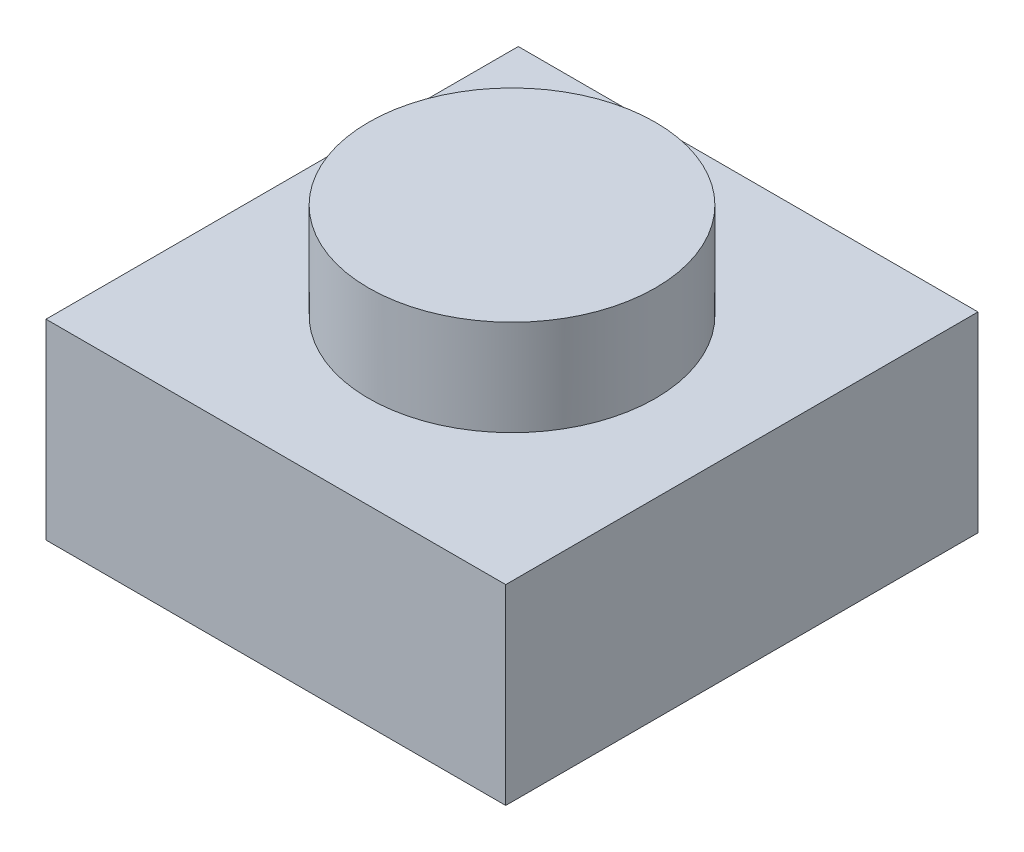
from build123d import *

# Parameters (mm, degrees)
BASEFRAMESKETCH_W    = 15.38
BASEFRAMESKETCH_H    = 3.2
BASEFRAME_DEPTH      = 7.9
SKETCH29_W           = 15.38
SKETCH29_H           = 7.9
CUT_EXTRUDE4_DEPTH   = 16.116827041
SKETCH31_R           = 2.197938665
BOSS_EXTRUDE6_DEPTH  = 1.6
LPATTERN4_COUNT      = 2
LPATTERN4_PITCH      = 8
SHELL1_T             = -1.2
BOSS_EXTRUDE7_DEPTH  = 2.3
CUT_EXTRUDE7_DEPTH   = 2.3
FILLET3_R            = 0.1
FILLET4_R            = 0.1
SKETCH38_W           = 7.69
SKETCH38_H           = 7.9
CUT_EXTRUDE8_DEPTH   = 4
BOSS_EXTRUDE16_START = 0.8
SKETCH44_R           = 0.997938665
BOSS_EXTRUDE16_DEPTH = 0.8
BOSS_EXTRUDE17_REACH = 13.769
SKETCH39_W           = 1.2
SKETCH39_H           = 5.5
CUT_EXTRUDE10_DEPTH  = 12.768845427
SKETCH46_W           = 0.335
SKETCH46_H           = 3.2
SKETCH100_W          = 0.349019596
SKETCH100_H          = 5.5
SKETCH101_W          = 0.3
SKETCH101_H          = 5.5
CUT_EXTRUDE27_DEPTH  = 11.500279785
SKETCH104_W          = 1.97
SKETCH104_H          = 1.97
CUT_EXTRUDE28_DEPTH  = 1.6
MOVE_FACE1_BY        = 3.3
CUT_EXTRUDE42_DEPTH  = 14.215613325
SKETCH118_R          = 2.4
SKETCH118_R_2        = 1.8
BOSS_EXTRUDE26_DEPTH = 1.6
SKETCH119_R          = 1.8
CUT_EXTRUDE43_DEPTH  = 12.160161573
SKETCH120_W          = 7.69000258
SKETCH120_H          = 3.3
CUT_EXTRUDE44_DEPTH  = 11.263488994
SKETCH121_R          = 1.8
BOSS_EXTRUDE27_DEPTH = 2.8


with BuildPart() as part:
    # BaseFrameSketch → BaseFrame (new, symmetric)
    with BuildSketch(Plane.XY):
        with Locations((-4.794729064, 1.6)):
            Rectangle(BASEFRAMESKETCH_W, BASEFRAMESKETCH_H)
    extrude(amount=BASEFRAME_DEPTH, both=True)

    # Sketch29 → Cut-Extrude4 (cut, through all)
    with BuildSketch(Plane(origin=(0, 3.2, 0), x_dir=(1, 0, 0), z_dir=(0, 1, 0))):
        with Locations((-4.794729064, 3.95)):
            Rectangle(SKETCH29_W, SKETCH29_H)
    extrude(amount=-CUT_EXTRUDE4_DEPTH, mode=Mode.SUBTRACT)

    # Sketch31 → Boss-Extrude6 (add)
    with BuildSketch(Plane(origin=(0, 3.2, 0), x_dir=(1, 0, 0), z_dir=(0, 1, 0))):
        with Locations((-8.584729064, -4)):
            Circle(SKETCH31_R)
    boss_extrude6 = extrude(amount=BOSS_EXTRUDE6_DEPTH)

    # LPattern4: Boss-Extrude6 ×2
    with Locations(*[(i * LPATTERN4_PITCH, 0, 0) for i in range(1, LPATTERN4_COUNT)]):
        add(boss_extrude6)

    # Shell1
    shell1_openings = [part.faces().sort_by_distance(p)[0] for p in [
        (-4.794729064, 0, 3.95),
    ]]
    offset(amount=SHELL1_T, openings=shell1_openings, kind=Kind.INTERSECTION)

    # Sketch35 → Boss-Extrude7 (add, symmetric)
    with BuildSketch(Plane.XY.offset(3.95)):
        with BuildLine():
            Line((-2.782667729, 3.2), (1.613209601, 3.2))
            ThreePointArc((1.613209601, 3.2), (1.721005084, 3.313571782), (1.810586387, 3.441999215))
            ThreePointArc((1.810586387, 3.441999215), (2.278525574, 4.313545175), (2.440270936, 5.289453921))
            ThreePointArc((2.440270936, 5.289453921), (2.428474077, 6.289536316), (2.360954202, 7.287406564))
            Line((2.360954202, 7.287406564), (1.106266226, 7.287406564))
            ThreePointArc((1.106266226, 7.287406564), (1.22292125, 6.096651625), (1.106266226, 4.905896686))
            ThreePointArc((1.106266226, 4.905896686), (-0.584729064, 4.033269084), (-2.275724354, 4.905896686))
            ThreePointArc((-2.275724354, 4.905896686), (-2.392379378, 6.096651625), (-2.275724354, 7.287406564))
            Line((-2.275724354, 7.287406564), (-3.53041233, 7.287406564))
            ThreePointArc((-3.53041233, 7.287406564), (-3.597932205, 6.289536316), (-3.609729064, 5.289453921))
            ThreePointArc((-3.609729064, 5.289453921), (-3.447983702, 4.313545175), (-2.980044515, 3.441999215))
            ThreePointArc((-2.980044515, 3.441999215), (-2.890463212, 3.313571782), (-2.782667729, 3.2))
        make_face()
    extrude(amount=BOSS_EXTRUDE7_DEPTH, both=True)

    # Sketch36 → Cut-Extrude7 (cut, symmetric)
    with BuildSketch(Plane.XY.offset(3.95)):
        with BuildLine():
            Line((-2.195211087, 4.8), (1.025752959, 4.8))
            ThreePointArc((1.025752959, 4.8), (-0.584729064, 4.033269084), (-2.195211087, 4.8))
        make_face()
    extrude(amount=CUT_EXTRUDE7_DEPTH, both=True, mode=Mode.SUBTRACT)

    # Fillet3
    fillet3_edges = [part.edges().sort_by_distance(p)[0] for p in [
        (-2.275724354, 4.905896686, 3.95),
    ]]
    fillet(fillet3_edges, radius=FILLET3_R)

    # Fillet4
    fillet4_edges = [part.edges().sort_by_distance(p)[0] for p in [
        (1.106266226, 4.905896686, 3.95),
    ]]
    fillet(fillet4_edges, radius=FILLET4_R)

    # Sketch38 → Cut-Extrude8 (cut, symmetric)
    with BuildSketch(Plane(origin=(0, 3.2, 0), x_dir=(1, 0, 0), z_dir=(0, 1, 0))):
        with Locations((-8.639729064, -3.95)):
            Rectangle(SKETCH38_W, SKETCH38_H)
    extrude(amount=CUT_EXTRUDE8_DEPTH, both=True, mode=Mode.SUBTRACT)

    # Sketch44 → Boss-Extrude16 (add)
    with BuildSketch(Plane.XZ.offset(-3.2).offset(BOSS_EXTRUDE16_START)):
        with Locations((-0.584729064, 4)):
            Circle(SKETCH44_R)
    extrude(amount=-BOSS_EXTRUDE16_DEPTH)

    # Sketch39 → Boss-Extrude17 (add, up to next)
    with BuildSketch(Plane(origin=(0, 0, 0), x_dir=(-1, 0, 0), z_dir=(0, -1, 0)), mode=Mode.PRIVATE) as boss_extrude17_sk1:
        with Locations((4.194729064, -3.95)):
            Rectangle(SKETCH39_W, SKETCH39_H)
    boss_extrude17_tool1 = extrude(boss_extrude17_sk1.sketch, amount=-BOSS_EXTRUDE17_REACH, mode=Mode.PRIVATE) - part.part
    add(boss_extrude17_tool1.solids().sort_by_distance((-4.194729, 0, 3.95))[0])

    # Sketch45 → Cut-Extrude10 (cut, through all)
    with BuildSketch(Plane.XY.offset(7.9)):
        Polygon((-4.794729064, 3.2), (-4.459731644, 3.2), (-4.459731644, 0), (-4.794729064, -0.001314844), align=None)
    extrude(amount=-CUT_EXTRUDE10_DEPTH, mode=Mode.SUBTRACT)

    # Sweep9: sweep along a curve in space
    with BuildLine() as sweep9_path:
        Line((2.895270936, 3.2, 7.9), (2.895270936, 3.2, 0))
    # Sketch46 → Sweep9 (sweep)
    with BuildSketch(Plane.XY.offset(7.9)):
        with Locations((3.062770936, 1.6)):
            Rectangle(SKETCH46_W, SKETCH46_H)
    sweep(path=sweep9_path.line)

    # Sweep24: sweep along a curve in space
    with BuildLine() as sweep24_path:
        Line((-3.594729064, 2, 6.7), (-3.594729064, 0, 6.7))
    # Sketch100 → Sweep24 (sweep)
    with BuildSketch(Plane(origin=(0, 2, 0), x_dir=(-1, 0, 0), z_dir=(0, -1, 0))):
        with Locations((3.420219266, -3.95)):
            Rectangle(SKETCH100_W, SKETCH100_H)
    sweep(path=sweep24_path.line)

    # Sketch101 → Cut-Extrude27 (cut, through all)
    with BuildSketch(Plane(origin=(0, 2, 0), x_dir=(-1, 0, 0), z_dir=(0, -1, 0))):
        with Locations((-1.845270936, -3.95)):
            Rectangle(SKETCH101_W, SKETCH101_H)
    extrude(amount=CUT_EXTRUDE27_DEPTH, mode=Mode.SUBTRACT)

    # Sketch104 → Cut-Extrude28 (cut)
    with BuildSketch(Plane(origin=(0, 2, 0), x_dir=(-1, 0, 0), z_dir=(0, -1, 0))):
        with Locations((0.625219266, -3.95)):
            Rectangle(SKETCH104_W, SKETCH104_H)
    extrude(amount=-CUT_EXTRUDE28_DEPTH, mode=Mode.SUBTRACT)

    # Sweep27: sweep along a curve in space
    with BuildLine() as sweep27_path:
        Line((0.359780734, 2, 3.677846589), (0.359780734, 2.4, 3.677846589))
    # Sketch105 → Sweep27 (sweep)
    with BuildSketch(Plane(origin=(0, 2, 0), x_dir=(-1, 0, 0), z_dir=(0, -1, 0))):
        with BuildLine():
            Line((-0.359780734, -3.677846589), (-0.359780734, -4.322153411))
            ThreePointArc((-0.359780734, -4.322153411), (-0.413209601, -4), (-0.359780734, -3.677846589))
        make_face()
        with BuildLine():
            Line((0.933522096, -4.935), (0.235936032, -4.935))
            ThreePointArc((0.235936032, -4.935), (0.584729064, -4.997938665), (0.933522096, -4.935))
        make_face()
    sweep(path=sweep27_path.line)

    # Move Face1: a face moved outward by 3.3
    extrude(part.faces().sort_by_distance((-0.614730354, 0, 0.79))[0], amount=MOVE_FACE1_BY, dir=(0, -1, 0))

    # Sketch115 → Cut-Extrude42 (cut, through all)
    with BuildSketch(Plane.ZY.offset(4.459731644)):
        Polygon((0, 3.2), (7.9, 3.2), (7.9, 7.494096257), (-0.222033581, 7.422914641), (-0.222033581, 3.2), align=None)
    extrude(amount=-CUT_EXTRUDE42_DEPTH, mode=Mode.SUBTRACT)

    # Sketch118 → Boss-Extrude26 (add)
    with BuildSketch(Plane(origin=(0, 3.2, 0), x_dir=(1, 0, 0), z_dir=(0, 1, 0))):
        with Locations((-0.614730354, -3.95)):
            Circle(SKETCH118_R)
        with Locations((-0.614730354, -3.95)):
            Circle(SKETCH118_R_2, mode=Mode.SUBTRACT)
    extrude(amount=BOSS_EXTRUDE26_DEPTH)

    # Sketch119 → Cut-Extrude43 (cut, through all)
    with BuildSketch(Plane(origin=(0, 3.2, 0), x_dir=(1, 0, 0), z_dir=(0, 1, 0))):
        with Locations((-0.614730354, -3.95)):
            Circle(SKETCH119_R)
    extrude(amount=-CUT_EXTRUDE43_DEPTH, mode=Mode.SUBTRACT)

    # Sketch120 → Cut-Extrude44 (cut, through all)
    with BuildSketch(Plane.XY.offset(7.9)):
        with Locations((-0.614730354, -1.65)):
            Rectangle(SKETCH120_W, SKETCH120_H)
    extrude(amount=-CUT_EXTRUDE44_DEPTH, mode=Mode.SUBTRACT)

    # Sketch121 → Boss-Extrude27 (add)
    with BuildSketch(Plane(origin=(0, 2, 0), x_dir=(-1, 0, 0), z_dir=(0, -1, 0))):
        with Locations((0.614730354, -3.95)):
            Circle(SKETCH121_R)
    extrude(amount=-BOSS_EXTRUDE27_DEPTH)


solid = part.part
